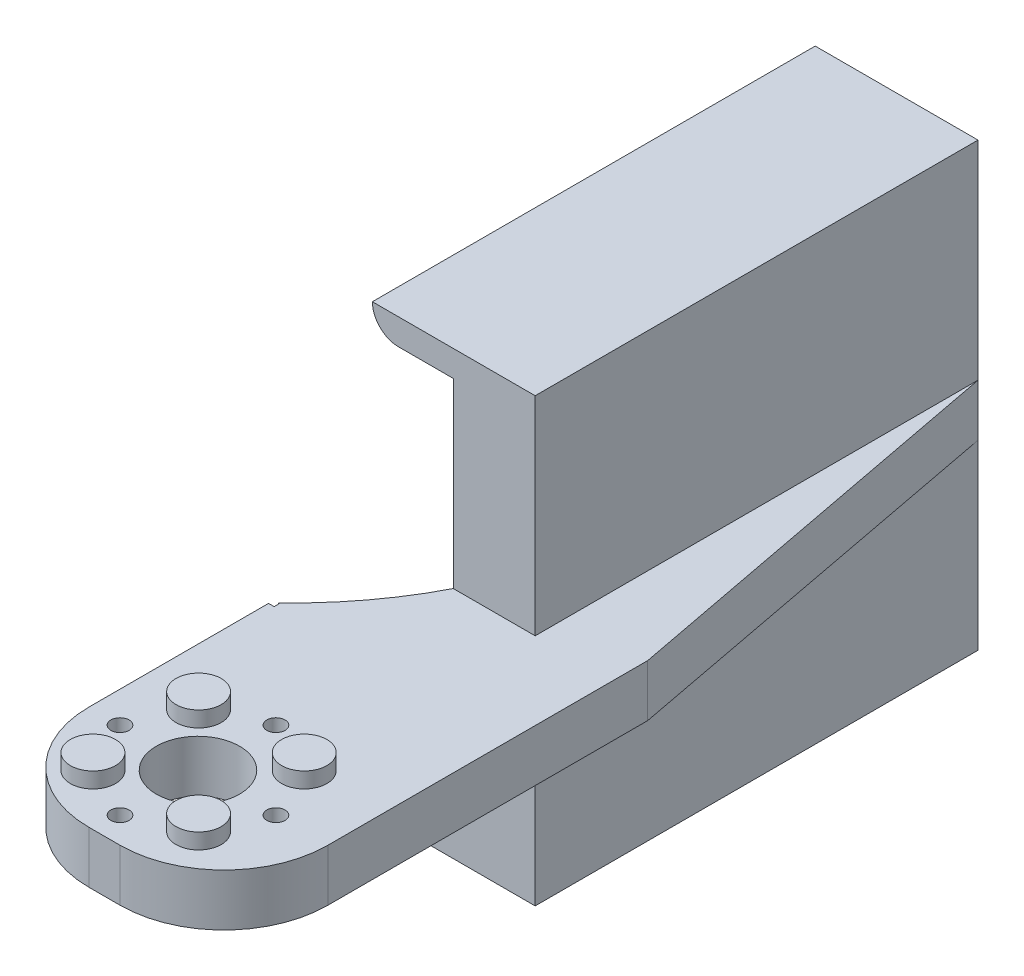
from build123d import *

# Parameters (mm, degrees)
SKETCH1_W                = 50
SKETCH1_H                = 140
BOSS_EXTRUDE1_DEPTH      = 10
SKETCH2_R                = 4.35
BOSS_EXTRUDE2_DEPTH      = 3
CIRPATTERN2_COUNT        = 8
SKETCH4_R                = 4.575
CUT_EXTRUDE3_DEPTH       = 3
SKETCH5_W                = 50
SKETCH5_H                = 10
BOSS_EXTRUDE3_DEPTH      = 70
SKETCH6_W                = 50
SKETCH6_H                = 50
CUT_EXTRUDE4_DEPTH       = 10
SKETCH7_R                = 1.75
CUT_EXTRUDE5_DEPTH       = 10
SKETCH8_W                = 4
SKETCH8_H                = 160
CUT_EXTRUDE6_DEPTH       = 10
CUT_EXTRUDE10_DEPTH      = 10
CUT_EXTRUDE9_DEPTH       = 10
SKETCH11_W               = 31.31699353
SKETCH11_H               = 105.183771494
BOSS_EXTRUDE4_DEPTH      = 40
FILLET1_R                = 20
FILLET2_R                = 20
SKETCH16_R               = 8
CUT_EXTRUDE15_DEPTH      = 10
CUT_EXTRUDE17_DEPTH      = 148.732867027
CUT_EXTRUDE17_DEPTH_BACK = 35
SKETCH18_W               = 31.31699353
SKETCH18_H               = 105.183771494
BOSS_EXTRUDE6_DEPTH      = 30
CUT_EXTRUDE20_DEPTH      = 164.171688721
CUT_EXTRUDE20_DEPTH_BACK = 30
SKETCH22_W               = 30.656149889
SKETCH22_H               = 104.820059864
BOSS_EXTRUDE7_DEPTH      = 5
SKETCH23_W               = 31.31699353
SKETCH23_H               = 20
CUT_EXTRUDE21_DEPTH      = 40
SKETCH24_W               = 30.656149889
SKETCH24_H               = 20
CUT_EXTRUDE22_DEPTH      = 35
SKETCH25_W               = 1.83885533
SKETCH25_H               = 1.068287382
CUT_EXTRUDE23_DEPTH      = 40
FILLET3_R                = 5
FILLET4_R                = 5


with BuildPart() as part:
    # Sketch1 → Boss-Extrude1 (new body)
    with BuildSketch(Plane(origin=(0, 0, 0), x_dir=(1, 0, 0), z_dir=(0, 1, 0))):
        Rectangle(SKETCH1_W, SKETCH1_H)
    extrude(amount=BOSS_EXTRUDE1_DEPTH)

    # Sketch2 → Boss-Extrude2 (add)
    with BuildSketch(Plane(origin=(0, 10, 0), x_dir=(1, 0, 0), z_dir=(0, 1, 0))):
        with Locations(Location((-14.25, 0, 0), (0, 0, 270))):
            Circle(SKETCH2_R)
    boss_extrude2 = extrude(amount=BOSS_EXTRUDE2_DEPTH)

    # CirPattern2: Boss-Extrude2 ×8 about axis
    cirpattern2_axis = Axis((0.122053198, 0, 0), (0, 1, 0))
    for i in range(1, CIRPATTERN2_COUNT):
        add(boss_extrude2.rotate(cirpattern2_axis, i * 360 / CIRPATTERN2_COUNT))

    # Sketch4 → Cut-Extrude3 (cut)
    with BuildSketch(Plane(origin=(0, 13, 0), x_dir=(1, 0, 0), z_dir=(0, 1, 0))):
        with Locations((-14.25, 0)):
            Circle(SKETCH4_R)
        with Locations((14.494106396, 0)):
            Circle(SKETCH4_R)
        with Locations((0.122053198, -14.372053198)):
            Circle(SKETCH4_R)
        with Locations((0.122053198, 14.372053198)):
            Circle(SKETCH4_R)
    extrude(amount=-CUT_EXTRUDE3_DEPTH, mode=Mode.SUBTRACT)

    # Sketch5 → Boss-Extrude3 (add)
    with BuildSketch(Plane(origin=(0, 0, -70), x_dir=(-1, 0, 0), z_dir=(0, 0, -1))):
        with Locations((0, 5)):
            Rectangle(SKETCH5_W, SKETCH5_H)
    extrude(amount=BOSS_EXTRUDE3_DEPTH)

    # Sketch6 → Cut-Extrude4 (cut)
    with BuildSketch(Plane(origin=(0, 10, 0), x_dir=(1, 0, 0), z_dir=(0, 1, 0))):
        with Locations((0, -45)):
            Rectangle(SKETCH6_W, SKETCH6_H)
    extrude(amount=-CUT_EXTRUDE4_DEPTH, mode=Mode.SUBTRACT)

    # Sketch7 → Cut-Extrude5 (cut)
    with BuildSketch(Plane(origin=(0, 10, 0), x_dir=(1, 0, 0), z_dir=(0, 1, 0))):
        with Locations(Location((15, 0, 0), (0, 0, 270))):
            Circle(SKETCH7_R)
        with Locations(Location((-15, 0, 0), (0, 0, 270))):
            Circle(SKETCH7_R)
        with Locations(Location((0, 15, 0), (0, 0, 270))):
            Circle(SKETCH7_R)
        with Locations(Location((0, -15, 0), (0, 0, 270))):
            Circle(SKETCH7_R)
    extrude(amount=-CUT_EXTRUDE5_DEPTH, mode=Mode.SUBTRACT)

    # Sketch8 → Cut-Extrude6 (cut)
    with BuildSketch(Plane(origin=(0, 10, 0), x_dir=(1, 0, 0), z_dir=(0, 1, 0))):
        with Locations((-23, 60)):
            Rectangle(SKETCH8_W, SKETCH8_H)
    extrude(amount=-CUT_EXTRUDE6_DEPTH, mode=Mode.SUBTRACT)

    # Sketch9 → Cut-Extrude10 (cut)
    with BuildSketch(Plane(origin=(0, 0, 0), x_dir=(-1, 0, 0), z_dir=(0, -1, 0))):
        Polygon((-10.051648387, 140), (-25, 61.50558626), (-25, 140), align=None)
    extrude(amount=-CUT_EXTRUDE10_DEPTH, mode=Mode.SUBTRACT)

    # Sketch10 → Cut-Extrude9 (cut)
    with BuildSketch(Plane(origin=(0, 0, 0), x_dir=(-1, 0, 0), z_dir=(0, -1, 0))):
        with BuildLine():
            Line((21, 34.816228506), (21, 140))
            ThreePointArc((21, 140), (-2.203275532, 87.408114253), (21, 34.816228506))
        make_face()
    extrude(amount=-CUT_EXTRUDE9_DEPTH, mode=Mode.SUBTRACT)

    # Sketch11 → Boss-Extrude4 (add)
    with BuildSketch(Plane(origin=(0, 10, 0), x_dir=(1, 0, 0), z_dir=(0, 1, 0))):
        with Locations((-5.606848378, 87.408114253)):
            Rectangle(SKETCH11_W, SKETCH11_H)
    extrude(amount=BOSS_EXTRUDE4_DEPTH)

    # Fillet1
    fillet1_edges = [part.edges().sort_by_distance(p)[0] for p in [
        (25, 5, 20),
    ]]
    fillet(fillet1_edges, radius=FILLET1_R)

    # Fillet2
    fillet2_edges = [part.edges().sort_by_distance(p)[0] for p in [
        (-21, 5, 20),
    ]]
    fillet(fillet2_edges, radius=FILLET2_R)

    # Sketch16 → Cut-Extrude15 (cut)
    with BuildSketch(Plane(origin=(0, 10, 0), x_dir=(1, 0, 0), z_dir=(0, 1, 0))):
        with Locations(Location((0, 0, 0), (0, 0, 270))):
            Circle(SKETCH16_R)
    extrude(amount=-CUT_EXTRUDE15_DEPTH, mode=Mode.SUBTRACT)

    # Sketch17 → Cut-Extrude17 (cut, two sides: drawn at the far end of the back side and taken through both)
    with BuildSketch(Plane(origin=(0, 10, 0), x_dir=(-1, 0, 0), z_dir=(0, -1, 0)).offset(-CUT_EXTRUDE17_DEPTH_BACK)):
        with BuildLine():
            Line((274.317595229, 371.200011147), (21, 140))
            ThreePointArc((21, 140), (-2.203275532, 87.408114253), (21, 34.816228506))
            Line((21, 34.816228506), (274.317595229, -196.383782641))
            Line((274.317595229, -196.383782641), (960.242515922, -196.383782641))
            Line((960.242515922, -196.383782641), (960.242515922, 371.200011147))
            Line((960.242515922, 371.200011147), (274.317595229, 371.200011147))
        make_face()
    extrude(amount=CUT_EXTRUDE17_DEPTH + CUT_EXTRUDE17_DEPTH_BACK, mode=Mode.SUBTRACT)

    # Sketch18 → Boss-Extrude6 (add)
    with BuildSketch(Plane(origin=(0, 0, 0), x_dir=(-1, 0, 0), z_dir=(0, -1, 0))):
        with Locations((5.606848378, 87.408114253)):
            Rectangle(SKETCH18_W, SKETCH18_H)
    extrude(amount=BOSS_EXTRUDE6_DEPTH)

    # Sketch21 → Cut-Extrude20 (cut, two sides: drawn at the far end of the back side and taken through both)
    with BuildSketch(Plane(origin=(0, -30, 0), x_dir=(-1, 0, 0), z_dir=(0, -1, 0)).offset(-CUT_EXTRUDE20_DEPTH_BACK)):
        with BuildLine():
            Line((268.426015736, 377.982607024), (21.265345143, 140))
            ThreePointArc((21.265345143, 140), (-1.103993451, 87.408114253), (21.265345143, 34.816228506))
            Line((21.265345143, 34.816228506), (268.426015736, -203.166378519))
            Line((268.426015736, -203.166378519), (954.644984679, -203.166378519))
            Line((954.644984679, -203.166378519), (954.644984679, 377.982607024))
            Line((954.644984679, 377.982607024), (268.426015736, 377.982607024))
        make_face()
    extrude(amount=CUT_EXTRUDE20_DEPTH + CUT_EXTRUDE20_DEPTH_BACK, mode=Mode.SUBTRACT)

    # Sketch22 → Boss-Extrude7 (add)
    with BuildSketch(Plane(origin=(0, -30, 0), x_dir=(-1, 0, 0), z_dir=(0, -1, 0))):
        with Locations((5.276426558, 87.589970068)):
            Rectangle(SKETCH22_W, SKETCH22_H)
    extrude(amount=BOSS_EXTRUDE7_DEPTH)

    # Sketch23 → Cut-Extrude21 (cut)
    with BuildSketch(Plane(origin=(0, 50, 0), x_dir=(1, 0, 0), z_dir=(0, 1, 0))):
        with Locations((-5.606848378, 44.816228506)):
            Rectangle(SKETCH23_W, SKETCH23_H)
    extrude(amount=-CUT_EXTRUDE21_DEPTH, mode=Mode.SUBTRACT)

    # Sketch24 → Cut-Extrude22 (cut)
    with BuildSketch(Plane(origin=(0, -35, 0), x_dir=(-1, 0, 0), z_dir=(0, -1, 0))):
        with Locations((5.276426558, 44.816228506)):
            Rectangle(SKETCH24_W, SKETCH24_H)
    extrude(amount=-CUT_EXTRUDE22_DEPTH, mode=Mode.SUBTRACT)

    # Sketch25 → Cut-Extrude23 (cut)
    with BuildSketch(Plane(origin=(0, -30, 0), x_dir=(-1, 0, 0), z_dir=(0, -1, 0))):
        with Locations((20.840871232, 35.107558697)):
            Rectangle(SKETCH25_W, SKETCH25_H)
    extrude(amount=-CUT_EXTRUDE23_DEPTH, mode=Mode.SUBTRACT)

    # Fillet3
    fillet3_edges = [part.edges().sort_by_distance(p)[0] for p in [
        (-21.265345143, 45, -97.408114253),
    ]]
    fillet(fillet3_edges, radius=FILLET3_R - 0.0001)  # a hair under: the kernel refuses the full size

    # Fillet4
    fillet4_edges = [part.edges().sort_by_distance(p)[0] for p in [
        (-20.604501502, -30, -97.085912401),
    ]]
    fillet(fillet4_edges, radius=FILLET4_R - 0.0001)  # a hair under: the kernel refuses the full size


solid = part.part
